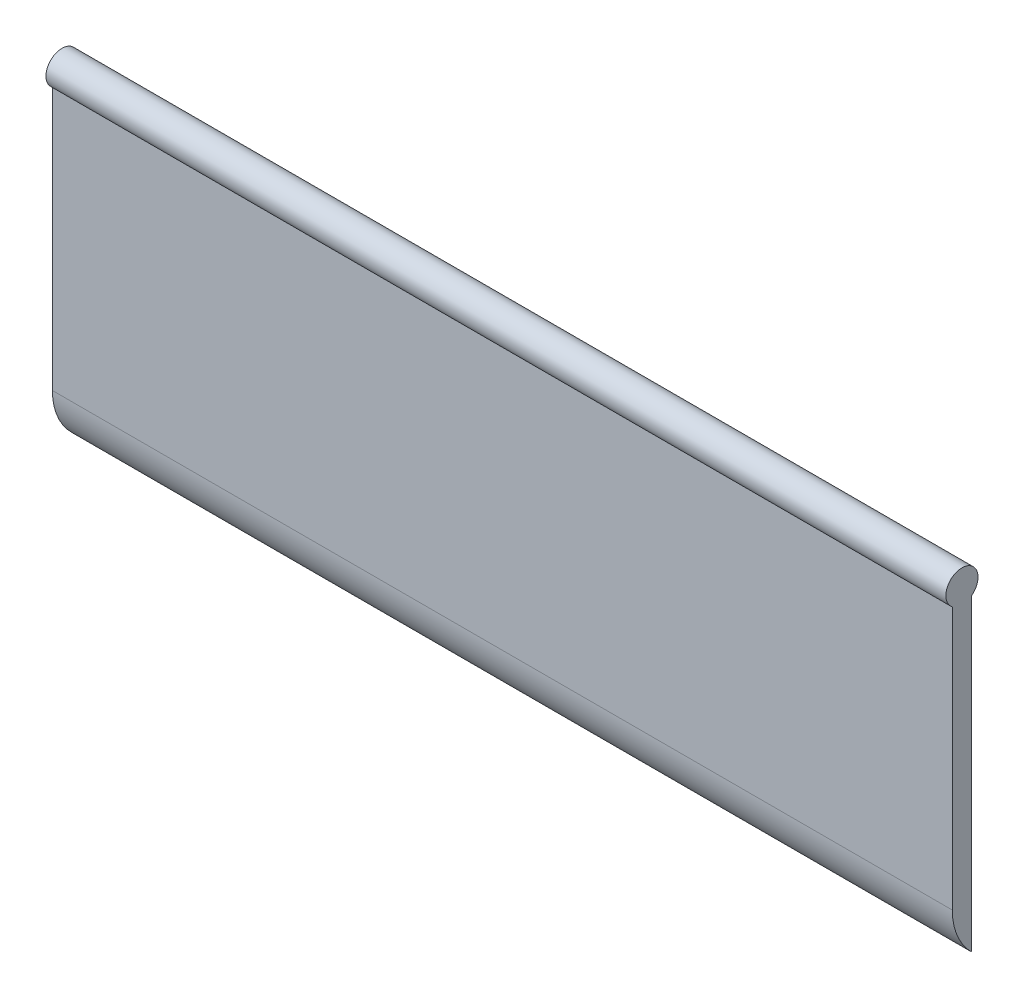
from build123d import *

# Parameters (mm, degrees)
BOSS_EXTRUDE1_DEPTH = 140
FILLET1_R           = 10


with BuildPart() as part:
    # Sketch1 → Boss-Extrude1 (new body)
    with BuildSketch(Plane(origin=(0, 0, 0), x_dir=(0, 0, -1), z_dir=(1, 0, 0))):
        with BuildLine():
            ThreePointArc((4, 50), (0.381966011, 52.236067977), (0, 48))
            Line((0, 48), (0, 50))
            Line((0, 50), (3, 50))
            Line((3, 50), (3, 48))
            ThreePointArc((3, 48), (3.736067977, 48.881966011), (4, 50))
        make_face()
        with BuildLine():
            Line((0, 50), (0, 48))
            ThreePointArc((0, 48), (1.5, 47.5), (3, 48))
            Line((3, 48), (3, 50))
            Line((3, 50), (0, 50))
        make_face()
        with BuildLine():
            Line((0, 48), (0, 0))
            Line((0, 0), (3, 0))
            Line((3, 0), (3, 48))
            ThreePointArc((3, 48), (1.5, 47.5), (0, 48))
        make_face()
    extrude(amount=BOSS_EXTRUDE1_DEPTH)

    # Fillet1
    # the kernel refuses this fillet: 10 mm, written as the material it takes off along each edge
    with BuildSketch(Plane(origin=(-17.853571071, 0, 0), x_dir=(0, 1, 0), z_dir=(1, 0, 0))) as fillet1_piece_1:
        with BuildLine():
            CenterArc((7.141428429, -10), FILLET1_R, 90, 45.572995999)
            Line((0, -3), (-0.142828569, -2.86))
            ThreePointArc((-0.142828569, -2.86), (-0.2, -1.5), (-0.2, 0))
            Line((-0.2, 0), (0, 0.2))
            Line((0, 0.2), (7.141428429, 0.2))
            Line((7.141428429, 0.2), (7.141428429, 0))
        make_face()
    extrude(amount=175.707142143, mode=Mode.SUBTRACT)


solid = part.part
